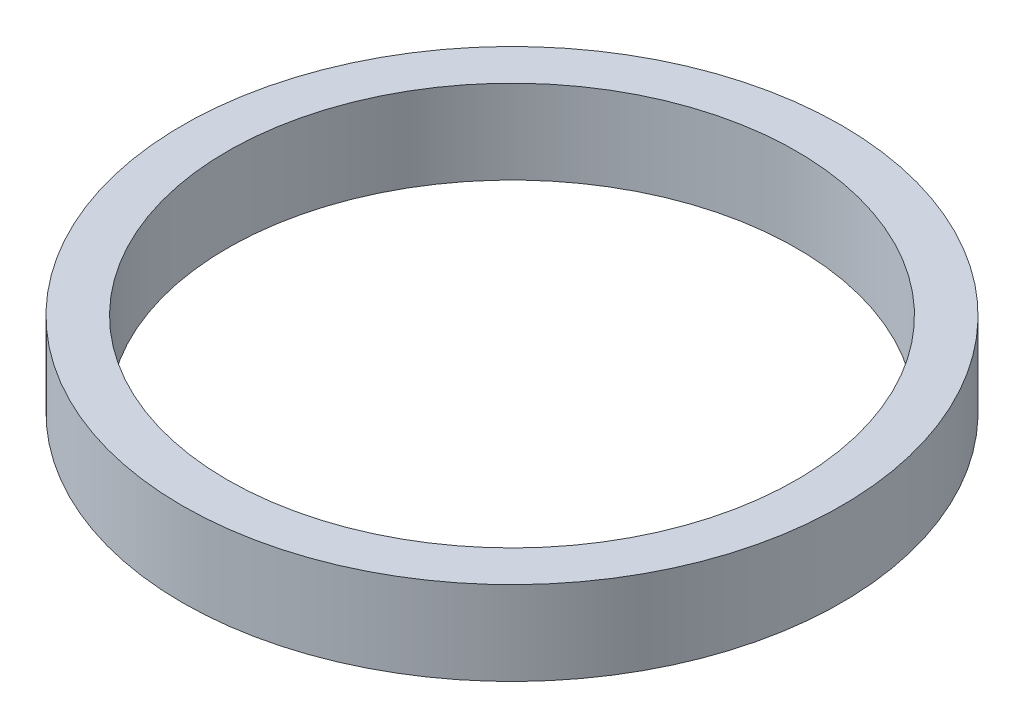
from build123d import *

# Parameters (mm, degrees)
SKETCH1_R           = 55
BOSS_EXTRUDE1_DEPTH = 14
SKETCH2_R           = 47.5
CUT_EXTRUDE1_DEPTH  = 80.031639234


with BuildPart() as part:
    # Sketch1 → Boss-Extrude1 (new body)
    with BuildSketch(Plane(origin=(0, 0, 0), x_dir=(1, 0, 0), z_dir=(0, 1, 0))):
        Circle(SKETCH1_R)
    extrude(amount=BOSS_EXTRUDE1_DEPTH)

    # Sketch2 → Cut-Extrude1 (cut, through all)
    with BuildSketch(Plane(origin=(0, 0, 0), x_dir=(1, 0, 0), z_dir=(0, 1, 0))):
        Circle(SKETCH2_R)
    extrude(amount=CUT_EXTRUDE1_DEPTH, mode=Mode.SUBTRACT)


solid = part.part
